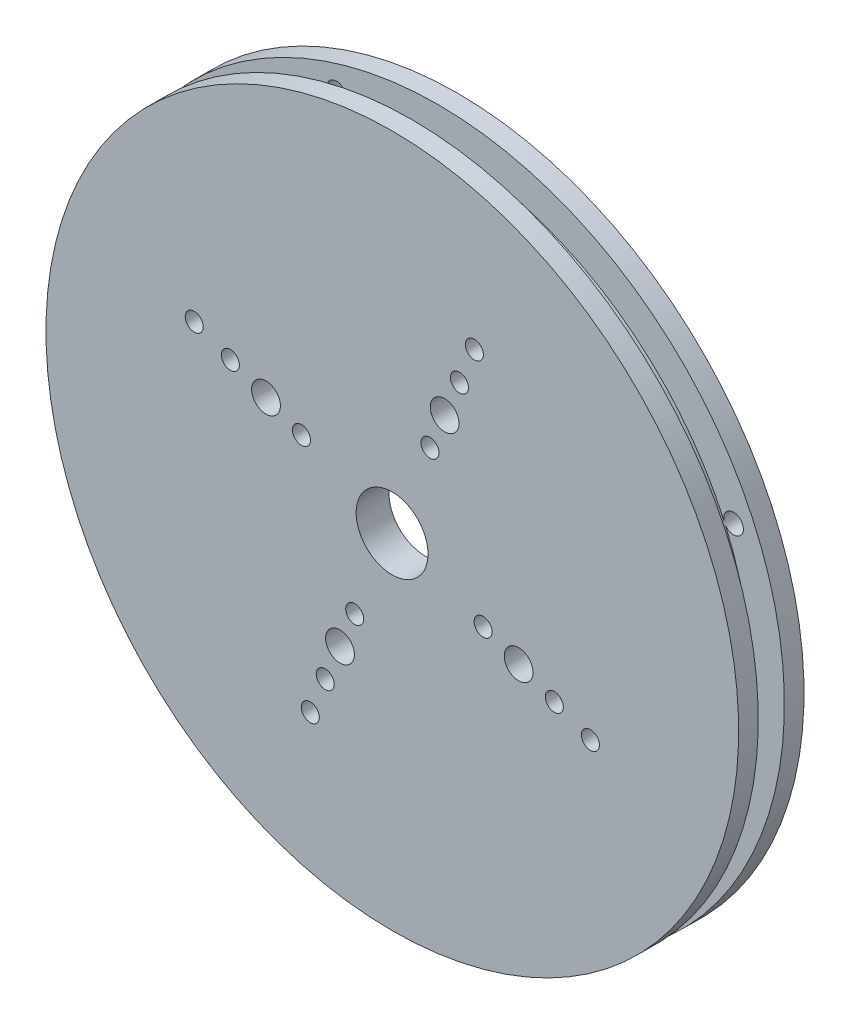
from build123d import *

# Parameters (mm, degrees)
ESQUISSE2_R             = 2.75
ENL_V_MAT_EXTRU_1_DEPTH = 10
ESQUISSE13_R            = 0.689564765
ESQUISSE13_R_2          = 1.1
ENL_V_MAT_EXTRU_4_DEPTH = 10
ENL_V_MAT_EXTRU_5_DEPTH = 2.5
ESQUISSE15_R            = 0.75
ENL_V_MAT_EXTRU_6_DEPTH = 2


with BuildPart() as part:
    # Esquisse1 → Révolution1 (revolve)
    with BuildSketch(Plane(origin=(0, 0, 1.686606393), x_dir=(0, 0, -1), z_dir=(1, 0, 0))):
        Polygon((1.67137312, -3), (1.67137312, 23.5), (0.17137312, 23.5), (0.17137312, 21), (-1.82862688, 21), (-1.82862688, 23.5), (-3.32862688, 23.5), (-3.32862688, -3), align=None)
    revolve(axis=Axis((0, -3, 1.515233274), (0, 0, 1)))

    # Esquisse2 → Enlèv. mat.-Extru.1 (cut)
    with BuildSketch(Plane.XY.offset(5.015233274)):
        with Locations((-0.018231274, -3.175370846)):
            Circle(ESQUISSE2_R)
    extrude(amount=-ENL_V_MAT_EXTRU_1_DEPTH, mode=Mode.SUBTRACT)

    # Esquisse13 → Enlèv. mat.-Extru.4 (cut)
    with BuildSketch(Plane.XY):
        with Locations((-2.877815561, -9.947559111)):
            Circle(ESQUISSE13_R)
        with Locations((6.947559111, -5.877815561)):
            Circle(ESQUISSE13_R)
        with Locations((9.663759082, -7.002918985)):
            Circle(ESQUISSE13_R_2)
        with Locations((12.393817217, -8.133762733)):
            Circle(ESQUISSE13_R)
        with Locations((15.156211065, -9.278000569)):
            Circle(ESQUISSE13_R)
        with Locations((2.877815561, 3.947559111)):
            Circle(ESQUISSE13_R)
        with Locations((4.002918985, 6.663759082)):
            Circle(ESQUISSE13_R_2)
        with Locations((5.133762733, 9.393817217)):
            Circle(ESQUISSE13_R)
        with Locations((6.278000569, 12.156211065)):
            Circle(ESQUISSE13_R)
        with Locations((-4.002918985, -12.663759082)):
            Circle(ESQUISSE13_R_2)
        with Locations((-5.133762733, -15.393817217)):
            Circle(ESQUISSE13_R)
        with Locations((-6.278000569, -18.156211065)):
            Circle(ESQUISSE13_R)
        with Locations((-6.947559111, -0.122184439)):
            Circle(ESQUISSE13_R)
        with Locations((-9.663759082, 1.002918985)):
            Circle(ESQUISSE13_R_2)
        with Locations((-12.393817217, 2.133762733)):
            Circle(ESQUISSE13_R)
        with Locations((-15.156211065, 3.278000569)):
            Circle(ESQUISSE13_R)
    extrude(amount=ENL_V_MAT_EXTRU_4_DEPTH, mode=Mode.SUBTRACT)

    # Esquisse14 → Enlèv. mat.-Extru.5 (cut)
    with BuildSketch(Plane.XY):
        with BuildLine():
            add(Edge.make_bspline(
                [(-0.834521935, 5.736060012), (-1.323561854, 4.206786323), (-2.604336043, 3.206660041), (-4.266586192, 3.071955003), (-5.739527965, 3.849312559)],
                knots=[-0.004811451, -0.004811451, -0.004811451, 0.373998328, 0.62653818, 1.005347959, 1.005347959, 1.005347959], degree=2))
            add(Edge.make_bspline(
                [(-5.739527965, 3.849312559), (-6.215062727, 3.931748239), (-7.18513586, 4.103529144), (-8.521385754, 4.347386976), (-9.8525478, 4.591251504), (-11.213312584, 4.834897157), (-12.421703021, 5.043723017), (-13.451716375, 5.209918112), (-14.279124381, 5.349514694), (-15.176302974, 5.354838403), (-16.01514225, 5.097393355), (-16.715602869, 4.596233984), (-17.154797612, 3.816013645), (-17.246922742, 2.915850366), (-16.972371092, 2.027473332), (-16.334691685, 1.422538372), (-15.722165203, 0.98450718), (-15.160149994, 0.564460476), (-14.444317483, 0.044435179), (-13.597049726, -0.561090872), (-12.573240224, -1.272829231), (-11.465820255, -2.02888463), (-10.398841116, -2.750817016), (-9.434985773, -3.402552324), (-8.881560832, -3.777197572), (-8.613882977, -3.958566886)],
                knots=[-0.001387734, -0.001387734, -0.001387734, -0.001387734, 0.061324894, 0.124037522, 0.18675015, 0.249462779, 0.312175407, 0.343531721, 0.374888035, 0.406244349, 0.437600663, 0.468956977, 0.500313291, 0.531669605, 0.563025919, 0.594382233, 0.625738548, 0.657094862, 0.688451176, 0.751163804, 0.813876432, 0.87658906, 0.939301688, 0.970658002, 1.002014316, 1.002014316, 1.002014316, 1.002014316], degree=3))
            add(Edge.make_bspline(
                [(-8.613882977, -3.958566886), (-7.115175315, -4.428435003), (-6.119086182, -5.654227733), (-5.957704531, -7.233576255), (-6.683427054, -8.639297758)],
                knots=[-0.005464898, -0.005464898, -0.005464898, 0.373559068, 0.626241712, 1.005265678, 1.005265678, 1.005265678], degree=2))
            add(Edge.make_bspline(
                [(-6.683427054, -8.639297758), (-6.736524361, -8.945610043), (-6.846666072, -9.577342021), (-7.042690275, -10.686674514), (-7.265854476, -11.930051113), (-7.506375972, -13.259401813), (-7.733828712, -14.537836364), (-7.926142256, -15.642839645), (-8.081969882, -16.60254416), (-8.217852425, -17.370429264), (-8.286620465, -18.25629548), (-8.064865225, -19.166982635), (-7.595647871, -19.938814159), (-6.805249095, -20.409255683), (-5.902998591, -20.361444051), (-5.05363368, -20.004133612), (-4.348361359, -19.395876796), (-3.700080535, -18.484475185), (-3.020597942, -17.507736588), (-2.269715572, -16.42953922), (-1.542463308, -15.3798635), (-0.772516376, -14.269564041), (-0.039679278, -13.216193215), (0.621403807, -12.269451004), (1.001226307, -11.726951139), (1.185184369, -11.464487256)],
                knots=[-0.001388305, -0.001388305, -0.001388305, -0.001388305, 0.029952258, 0.061292822, 0.123973949, 0.186655076, 0.249336203, 0.31201733, 0.343357894, 0.374698458, 0.406039021, 0.437379585, 0.468720148, 0.500060712, 0.531401276, 0.562741839, 0.594082403, 0.625422966, 0.688104094, 0.750785221, 0.813466348, 0.876147475, 0.938828602, 0.970169166, 1.00150973, 1.00150973, 1.00150973, 1.00150973], degree=3))
            add(Edge.make_bspline(
                [(1.185184369, -11.464487256), (1.65490631, -10.059324715), (2.829358422, -9.15844428), (4.33447116, -9.05073647), (5.670220815, -9.779713653)],
                knots=[-0.006505251, -0.006505251, -0.006505251, 0.373008228, 0.626017214, 1.005530693, 1.005530693, 1.005530693], degree=2))
            add(Edge.make_bspline(
                [(5.670220815, -9.779713653), (6.569459508, -9.916444916), (7.901232109, -10.093165819), (9.759113621, -10.347529942), (11.17252884, -10.561212218), (12.369040829, -10.770551448), (13.339136626, -10.966848112), (14.065124948, -11.124018436), (14.821895835, -11.319046534), (15.70861899, -11.312430159), (16.534204861, -10.936968), (17.182071527, -10.310137698), (17.46484991, -9.429689564), (17.318925746, -8.547107531), (16.868617318, -7.786086578), (16.246601622, -7.307558249), (15.666761077, -6.904515186), (14.884513279, -6.351538957), (13.911192215, -5.672398343), (12.742499913, -4.856303143), (11.187695713, -3.765151227), (10.012709728, -2.923155523), (9.239873833, -2.355364652)],
                knots=[-0.002298263, -0.002298263, -0.002298263, -0.002298263, 0.123303723, 0.186104716, 0.248905709, 0.311706702, 0.343107198, 0.374507695, 0.405908192, 0.437308688, 0.468709185, 0.500109681, 0.531510178, 0.562910674, 0.594311171, 0.625711667, 0.657112164, 0.68851266, 0.751313653, 0.814114646, 0.876915639, 1.002517625, 1.002517625, 1.002517625, 1.002517625], degree=3))
            add(Edge.make_bspline(
                [(9.239873833, -2.355364652), (7.570556122, -1.863499203), (6.434531603, -0.547970888), (6.224755639, 1.141501953), (6.996491401, 2.645273855)],
                knots=[-0.004925251, -0.004925251, -0.004925251, 0.374046612, 0.62669452, 1.005666382, 1.005666382, 1.005666382], degree=2))
            add(Edge.make_bspline(
                [(6.996491401, 2.645273855), (7.027959892, 2.817346112), (7.083924673, 3.148814023), (7.1936659, 3.923344094), (7.32371884, 5.006057526), (7.494019942, 6.463811724), (7.699325151, 8.02176849), (7.917067912, 9.357588835), (8.130539857, 10.427981639), (8.310516379, 11.208029269), (8.52290283, 12.033801752), (8.398362089, 12.962975893), (7.885021118, 13.729666175), (6.856960913, 14.4307326), (5.569353873, 14.314542315), (4.608438514, 13.601362603), (4.146393984, 12.928647397), (3.737616682, 12.315820412), (3.186319926, 11.514298153), (2.511403124, 10.551718459), (1.702996836, 9.416222225), (0.8835841, 8.260635797), (0.05047789, 7.063148514), (-0.546817155, 6.17332486), (-0.834521935, 5.736060012)],
                knots=[-0.001626184, -0.001626184, -0.001626184, -0.001626184, 0.029764798, 0.061155781, 0.123937746, 0.186719712, 0.249501677, 0.312283642, 0.343674625, 0.375065608, 0.40645659, 0.437847573, 0.469238555, 0.500629538, 0.563411503, 0.594802486, 0.626193469, 0.657584451, 0.688975434, 0.751757399, 0.814539365, 0.87732133, 0.940103295, 1.002885261, 1.002885261, 1.002885261, 1.002885261], degree=3))
        make_face()
    extrude(amount=ENL_V_MAT_EXTRU_5_DEPTH, mode=Mode.SUBTRACT)

    # Esquisse15 → Enlèv. mat.-Extru.6 (cut)
    with BuildSketch(Plane(origin=(0, 0, 0.015233274), x_dir=(-1, 0, 0), z_dir=(0, 0, -1))):
        with Locations((-22.609388566, 7.039369732)):
            Circle(ESQUISSE15_R)
        with Locations((24.146091176, -9.023146598)):
            Circle(ESQUISSE15_R)
        with Locations((7.769655032, 20.409911311)):
            Circle(ESQUISSE15_R)
        with Locations((-10.502219424, -25.662483195)):
            Circle(ESQUISSE15_R)
    extrude(amount=-ENL_V_MAT_EXTRU_6_DEPTH, mode=Mode.SUBTRACT)


solid = part.part
